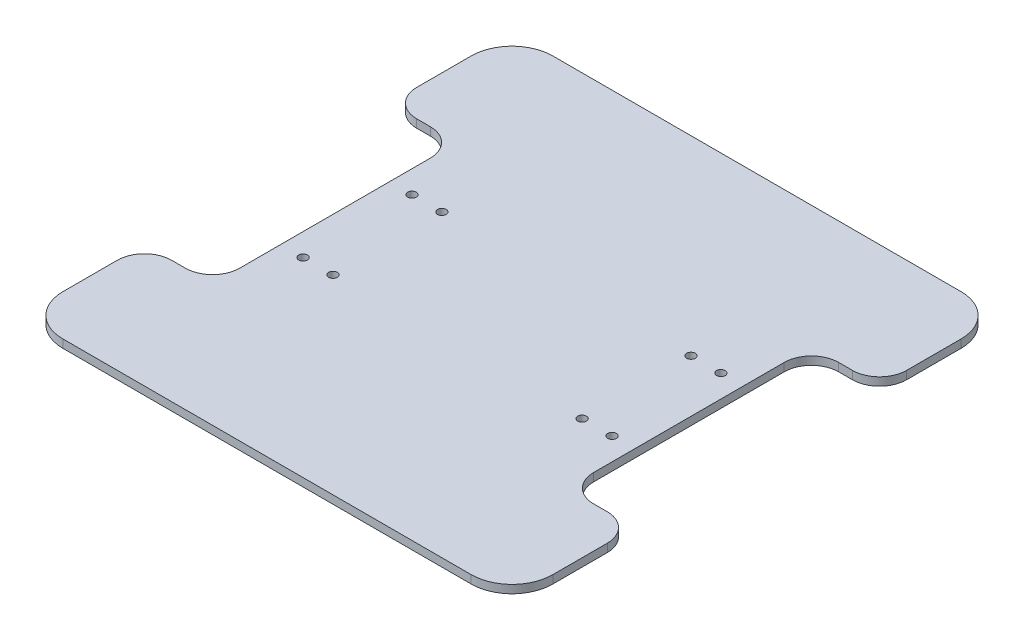
from build123d import *

# Parameters (mm, degrees)
SKETCH1_W           = 180
SKETCH1_H           = 180
BOSS_EXTRUDE1_DEPTH = 3
FILLET1_R           = 15
SKETCH2_R           = 1.6
SKETCH2_W           = 25
SKETCH2_H           = 90
CUT_EXTRUDE2_DEPTH  = 128.314571044
FILLET2_R           = 10


with BuildPart() as part:
    # Sketch1 → Boss-Extrude1 (new body)
    with BuildSketch(Plane(origin=(0, 0, 0), x_dir=(1, 0, 0), z_dir=(0, 1, 0))):
        Rectangle(SKETCH1_W, SKETCH1_H)
    extrude(amount=BOSS_EXTRUDE1_DEPTH)

    # Fillet1
    fillet1_edges = [part.edges().sort_by_distance(p)[0] for p in [
        (-90, 1.5, -90),
        (90, 1.5, -90),
        (-90, 1.5, 90),
        (90, 1.5, 90),
    ]]
    fillet(fillet1_edges, radius=FILLET1_R)

    # Sketch2 → Cut-Extrude2 (cut, through all)
    with BuildSketch(Plane(origin=(0, 3, 0), x_dir=(1, 0, 0), z_dir=(0, 1, 0))):
        with Locations((-56.75, 20)):
            Circle(SKETCH2_R)
        with Locations((-45.75, 20)):
            Circle(SKETCH2_R)
        with Locations((-56.75, -20)):
            Circle(SKETCH2_R)
        with Locations((-45.75, -20)):
            Circle(SKETCH2_R)
        with Locations((45.75, 20)):
            Circle(SKETCH2_R)
        with Locations((56.75, 20)):
            Circle(SKETCH2_R)
        with Locations((45.75, -20)):
            Circle(SKETCH2_R)
        with Locations((56.75, -20)):
            Circle(SKETCH2_R)
        with Locations((-77.5, 0)):
            Rectangle(SKETCH2_W, SKETCH2_H)
        with Locations((77.5, 0)):
            Rectangle(SKETCH2_W, SKETCH2_H)
    extrude(amount=-CUT_EXTRUDE2_DEPTH, mode=Mode.SUBTRACT)

    # Fillet2
    fillet2_edges = [part.edges().sort_by_distance(p)[0] for p in [
        (-65, 1.5, 45),
        (-65, 1.5, -45),
        (65, 1.5, -45),
        (65, 1.5, 45),
        (90, 1.5, -45),
        (90, 1.5, 45),
        (-90, 1.5, 45),
        (-90, 1.5, -45),
    ]]
    fillet(fillet2_edges, radius=FILLET2_R)


solid = part.part
